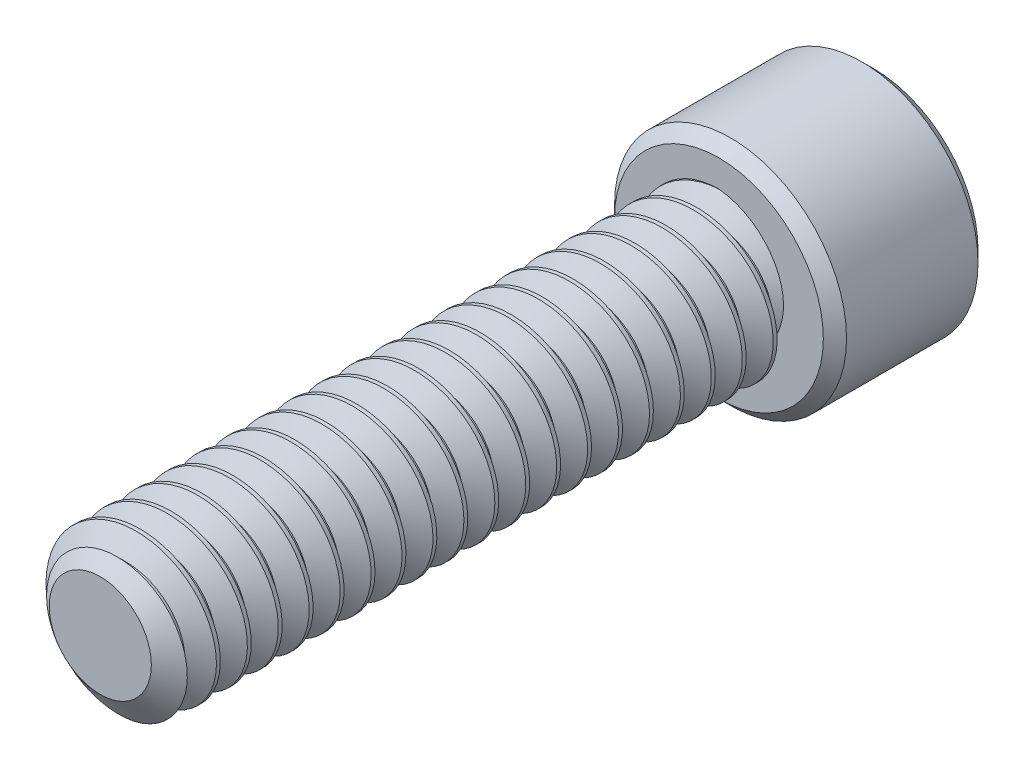
from build123d import *

# Parameters (mm, degrees)
SKETCH1_R          = 3.175
EXTRUDE1_DEPTH     = 25.4
CUT_SWEEP1_PITCH   = 1.27
SKETCH6_R          = 4.7625
EXTRUDE2_DEPTH     = 6.35
CUT_EXTRUDE1_DEPTH = 3.571875
CHAMFER1_SIZE      = 0.47625


with BuildPart() as part:
    # Sketch1 → Extrude1 (new body)
    with BuildSketch(Plane.XY):
        Circle(SKETCH1_R)
    extrude(amount=-EXTRUDE1_DEPTH)

    # Cut-Sweep1: arcs per turn and ends read off the stored shape
    # Cut-Sweep1: the profile of Sketch3 profile screwed along a right-hand helix through 23 turns, 6 arcs to a turn; built about Z, then put on its axis
    cut_sweep1_z = Axis((0, 0, 0), (0, 0, 1))
    cut_sweep1_corners = [(3.1753, 0, -2.381423205), (2.350110803, 0, -1.905), (2.350110803, 0, -1.74625), (3.1753, 0, -1.269826795)]
    with BuildLine(mode=Mode.PRIVATE) as cut_sweep1_profile:
        Line(cut_sweep1_corners[0], cut_sweep1_corners[1])
        Line(cut_sweep1_corners[1], cut_sweep1_corners[2])
        Line(cut_sweep1_corners[2], cut_sweep1_corners[3])
        Line(cut_sweep1_corners[3], cut_sweep1_corners[0])
    cut_sweep1_cap = Face(cut_sweep1_profile.wire())
    cut_sweep1_turn_angles = [0, 30, 60, 90, 120, 150, 180, 210, 240, 270, 300, 330, 360]
    cut_sweep1_turn_weights = [1, 0.8660254037844387, 1, 0.8660254037844387, 1, 0.8660254037844387, 1, 0.8660254037844387, 1, 0.8660254037844387, 1, 0.8660254037844387, 1]
    cut_sweep1_turn_rails = [Edge.make_bspline([Vector(p[0], p[1], 0).rotate(cut_sweep1_z, cut_sweep1_turn_angles[k]) / cut_sweep1_turn_weights[k] + Vector(0, 0, p[2] + CUT_SWEEP1_PITCH * cut_sweep1_turn_angles[k] / 360) for k in range(13)], [0, 0, 0, 1, 1, 2, 2, 3, 3, 4, 4, 5, 5, 6, 6, 6], 2, cut_sweep1_turn_weights) for p in cut_sweep1_corners]
    cut_sweep1_turn_sides = [Face.make_surface_from_curves(cut_sweep1_turn_rails[p[0]], cut_sweep1_turn_rails[p[1]]) for p in [(0, 1), (1, 2), (2, 3), (3, 0)]]
    cut_sweep1 = Plane(origin=(0, 0, 0), x_dir=(0, 1, 0), z_dir=(0, 0, -1)) * Solid(Shell([*[p.moved(Location((0, 0, CUT_SWEEP1_PITCH * i))) for i in range(23) for p in cut_sweep1_turn_sides], cut_sweep1_cap, cut_sweep1_cap.rotate(cut_sweep1_z, 8280).moved(Location((0, 0, CUT_SWEEP1_PITCH * 8280 / 360)))]))
    add(cut_sweep1, mode=Mode.SUBTRACT)

    # Sketch4 → Cut-Revolve1 (revolve, cut)
    with BuildSketch(Plane(origin=(0, 0, 0), x_dir=(0, 0, -1), z_dir=(1, 0, 0)), mode=Mode.PRIVATE) as cut_revolve1_sk:
        Polygon((0.755446349, 3.175), (0, 2.096110803), (0, 3.175), align=None)
    revolve(cut_revolve1_sk.sketch.rotate(Axis((0, 0, 0), (0, 0, -1)), 270), axis=Axis((0, 0, 0), (0, 0, -1)), mode=Mode.SUBTRACT)

    # Sketch6 → Extrude2 (add)
    with BuildSketch(Plane(origin=(0, 0, -25.4), x_dir=(-1, 0, 0), z_dir=(0, 0, -1))):
        Circle(SKETCH6_R)
    extrude(amount=EXTRUDE2_DEPTH)

    # Sketch7 → Cut-Extrude1 (cut)
    with BuildSketch(Plane(origin=(0, 0, -31.75), x_dir=(-1, 0, 0), z_dir=(0, 0, -1))):
        Polygon((0, 2.749630657), (-2.38125, 1.374815329), (-2.38125, -1.374815329), (0, -2.749630657), (2.38125, -1.374815329), (2.38125, 1.374815329), align=None)
    extrude(amount=-CUT_EXTRUDE1_DEPTH, mode=Mode.SUBTRACT)

    # Cut-Extrude2 cone 1 section (through the dimple's axis) → Cut-Extrude2 (revolve, cut)
    with BuildSketch(Plane(origin=(0, 0, -31.75), x_dir=(0, 1, 0), z_dir=(1, 0, 0))):
        Polygon((0, 0), (2.749630657, 0), (0, 2.749630657), align=None)
    revolve(axis=Axis((0, 0, -31.75), (0, 0, 1)), mode=Mode.SUBTRACT)

    # Chamfer1
    chamfer1_edges = [part.edges().sort_by_distance(p)[0] for p in [
        (4.7625, 0, -25.4),
        (4.7625, 0, -31.75),
    ]]
    chamfer(chamfer1_edges, length=CHAMFER1_SIZE)


solid = part.part
